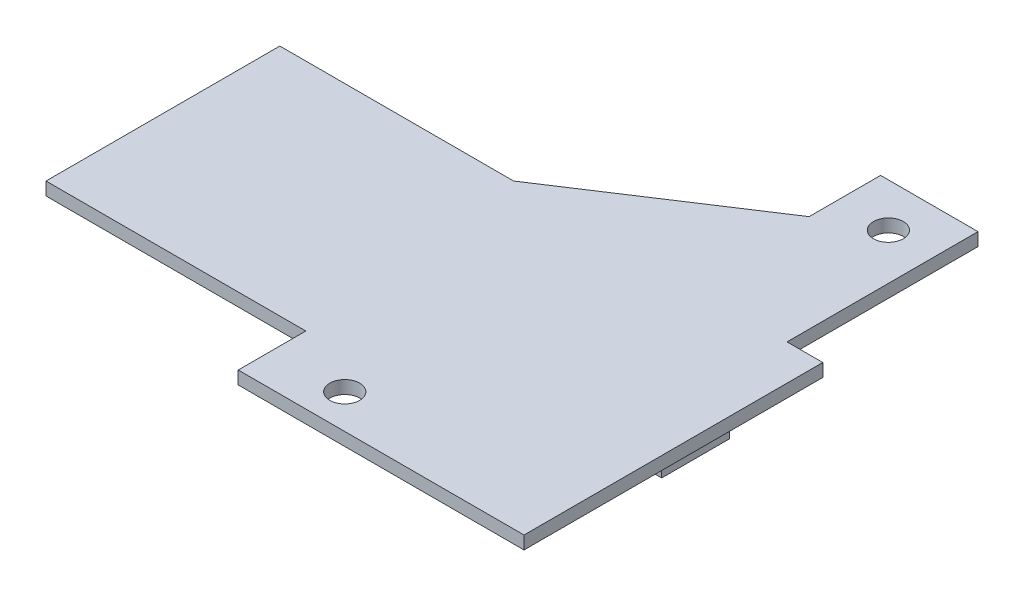
from build123d import *

# Parameters (mm, degrees)
EXTRUDE_1_DEPTH     = 1
SKETCH_2_R          = 1.15
CUT_EXTRUDE_1_DEPTH = 54.115440316
SKETCH_3_R          = 1.15
CUT_EXTRUDE_2_DEPTH = 54.115440316
SKETCH_4_W          = 5.2
SKETCH_4_H          = 5.2
EXTRUDE_2_DEPTH     = 1.5


with BuildPart() as part:
    # Эскиз1 → Бобышка-Вытянуть1 (new body)
    with BuildSketch(Plane(origin=(0, 0, 0), x_dir=(1, 0, 0), z_dir=(0, 1, 0))):
        Polygon((0, 0), (0, 18), (18, 18), (31.75, 27), (31.75, 32.5), (39.25, 32.5), (39.25, 17.8), (42, 17.8), (42, -5.2), (20, -5.2), (20, 0), align=None)
    extrude(amount=EXTRUDE_1_DEPTH)

    # Эскиз2 → Вырез-Вытянуть1 (cut, through all)
    with BuildSketch(Plane(origin=(0, 1, 0), x_dir=(1, 0, 0), z_dir=(0, 1, 0))):
        with Locations((35.7, 29.15)):
            Circle(SKETCH_2_R)
    extrude(amount=-CUT_EXTRUDE_1_DEPTH, mode=Mode.SUBTRACT)

    # Эскиз3 → Вырез-Вытянуть2 (cut, through all)
    with BuildSketch(Plane(origin=(0, 1, 0), x_dir=(1, 0, 0), z_dir=(0, 1, 0))):
        with Locations((25.55, -2.55)):
            Circle(SKETCH_3_R)
    extrude(amount=-CUT_EXTRUDE_2_DEPTH, mode=Mode.SUBTRACT)

    # Эскиз4 → Бобышка-Вытянуть2 (add)
    with BuildSketch(Plane.XZ):
        with Locations((38.4, -9)):
            Rectangle(SKETCH_4_W, SKETCH_4_H)
    extrude(amount=EXTRUDE_2_DEPTH)


solid = part.part
